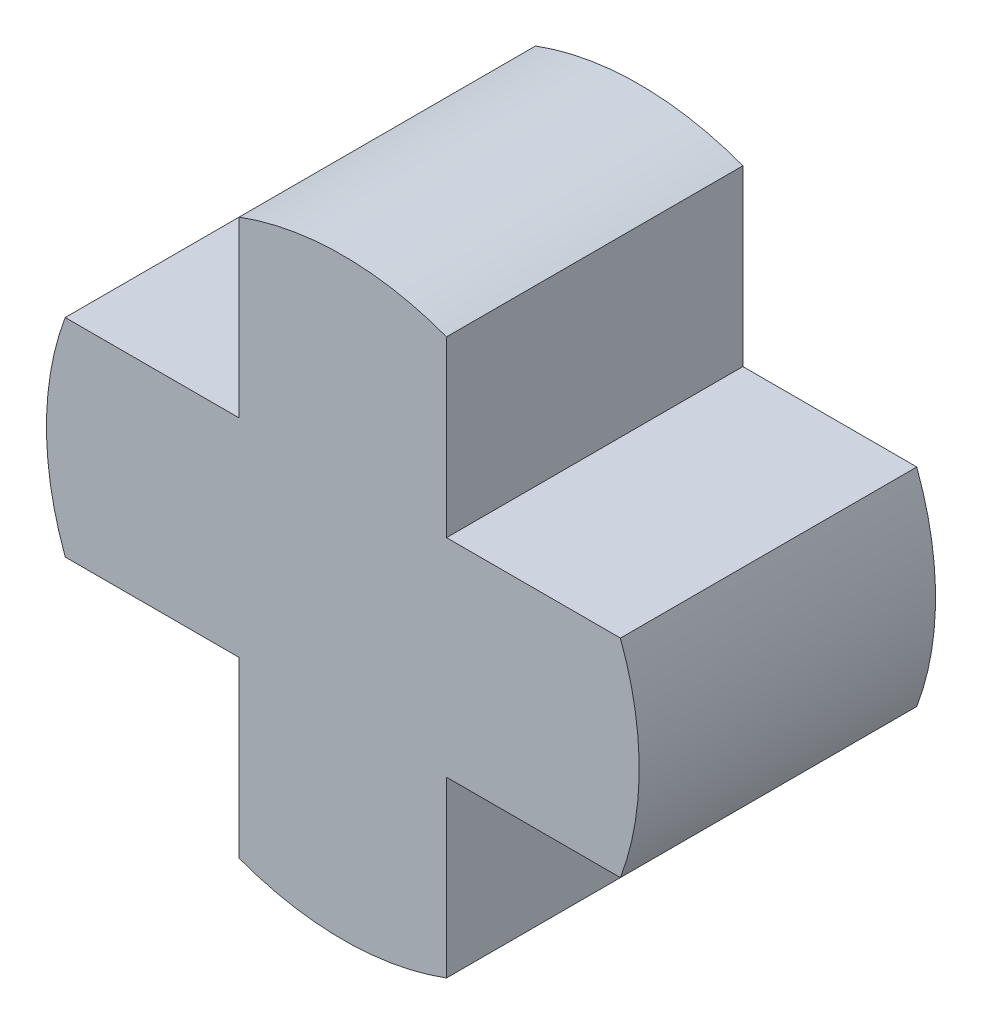
from build123d import *

# Parameters (mm, degrees)
EXTRUDE_1_DEPTH = 10


with BuildPart() as part:
    # 스케치1 → 보스-돌출1 (new body)
    with BuildSketch(Plane.XY):
        with BuildLine():
            ThreePointArc((-3.5, -9.367496998), (0, -10), (3.5, -9.367496998))
            Line((3.5, -9.367496998), (3.5, -3.5))
            Line((3.5, -3.5), (9.367496998, -3.5))
            ThreePointArc((9.367496998, -3.5), (10, 0), (9.367496998, 3.5))
            Line((9.367496998, 3.5), (3.5, 3.5))
            Line((3.5, 3.5), (3.5, 9.367496998))
            ThreePointArc((3.5, 9.367496998), (0, 10), (-3.5, 9.367496998))
            Line((-3.5, 9.367496998), (-3.5, 3.5))
            Line((-3.5, 3.5), (-9.367496998, 3.5))
            ThreePointArc((-9.367496998, 3.5), (-10, 0), (-9.367496998, -3.5))
            Line((-9.367496998, -3.5), (-3.5, -3.5))
            Line((-3.5, -3.5), (-3.5, -9.367496998))
        make_face()
    extrude(amount=EXTRUDE_1_DEPTH)


solid = part.part
